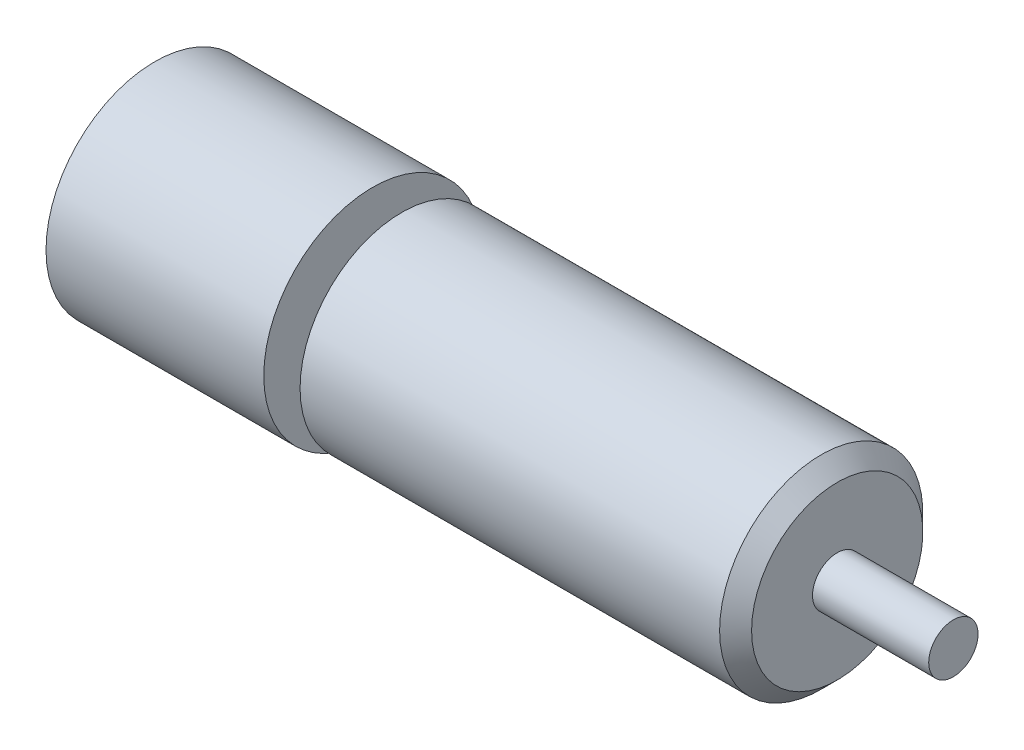
from build123d import *


# Read off the part's stored shape, not the designer's step: M14x2.0 Machine Threads Stud1
with BuildPart() as part:
    # Sketch1 → Revolve1 (revolve)
    with BuildSketch(Plane.XY, mode=Mode.PRIVATE) as revolve1_sk:
        Polygon((0, 0), (0, 7.5), (15, 7.5), (15, 3.75), (17, 3.75), (17, 7.5), (47, 7.5), (47, 1.7), (55, 1.7), (55, 0), align=None)
    revolve(revolve1_sk.sketch.rotate(Axis((-20.400760227, 0, 0), (1, 0, 0)), 90), axis=Axis((-20.400760227, 0, 0), (1, 0, 0)))

    # M14x2.0 Machine Threads Stud1 outline → M14x2.0 Machine Threads Stud1 (revolve, cut)
    with BuildSketch(Plane.YX):
        Polygon((7.5, 47), (5.8985, 47), (7, 45.8985), (7, 17), (7.5, 17), align=None)
    revolve(axis=Axis((0, 0, 0), (1, 0, 0)), mode=Mode.SUBTRACT)


solid = part.part
